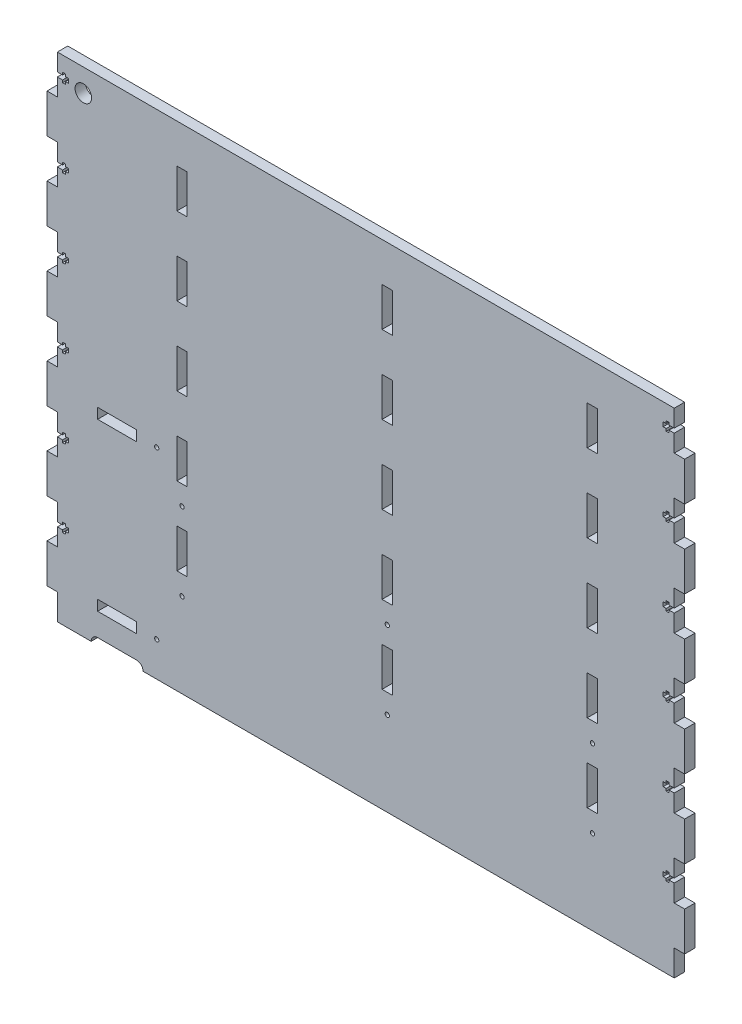
from build123d import *

# Parameters (mm, degrees)
SKETCH1_W           = 475
SKETCH1_H           = 380
SKETCH1_R           = 6.35
SKETCH1_R_2         = 1.65
SKETCH1_W_2         = 8
SKETCH1_H_2         = 30
SKETCH1_W_3         = 30
SKETCH1_H_3         = 8
BOSS_EXTRUDE1_DEPTH = 8
SKETCH2_W           = 8
SKETCH2_H           = 30
BOSS_EXTRUDE2_DEPTH = 8
CUT_EXTRUDE2_DEPTH  = 615.616140367


with BuildPart() as part:
    # Sketch1 → Boss-Extrude1 (new body)
    with BuildSketch(Plane.XY):
        with Locations((237.5, 190)):
            Rectangle(SKETCH1_W, SKETCH1_H)
        with Locations((20, 362.5)):
            Circle(SKETCH1_R, mode=Mode.SUBTRACT)
        with Locations((76.5, 154.566938385)):
            Circle(SKETCH1_R_2, mode=Mode.SUBTRACT)
        with Locations((76.5, 26.566938385)):
            Circle(SKETCH1_R_2, mode=Mode.SUBTRACT)
        with Locations((96, 125)):
            Circle(SKETCH1_R_2, mode=Mode.SUBTRACT)
        with Locations((254, 125)):
            Circle(SKETCH1_R_2, mode=Mode.SUBTRACT)
        with Locations((412, 125)):
            Circle(SKETCH1_R_2, mode=Mode.SUBTRACT)
        with Locations((96, 65)):
            Circle(SKETCH1_R_2, mode=Mode.SUBTRACT)
        with Locations((254, 65)):
            Circle(SKETCH1_R_2, mode=Mode.SUBTRACT)
        with Locations((412, 65)):
            Circle(SKETCH1_R_2, mode=Mode.SUBTRACT)
        with Locations((254, 335)):
            Rectangle(SKETCH1_W_2, SKETCH1_H_2, mode=Mode.SUBTRACT)
        with Locations((46, 154.566938385)):
            Rectangle(SKETCH1_W_3, SKETCH1_H_3, mode=Mode.SUBTRACT)
        with Locations((46, 26.566938385)):
            Rectangle(SKETCH1_W_3, SKETCH1_H_3, mode=Mode.SUBTRACT)
        with Locations((96, 335)):
            Rectangle(SKETCH1_W_2, SKETCH1_H_2, mode=Mode.SUBTRACT)
        with Locations((412, 335)):
            Rectangle(SKETCH1_W_2, SKETCH1_H_2, mode=Mode.SUBTRACT)
        with Locations((96, 275)):
            Rectangle(SKETCH1_W_2, SKETCH1_H_2, mode=Mode.SUBTRACT)
        with Locations((254, 275)):
            Rectangle(SKETCH1_W_2, SKETCH1_H_2, mode=Mode.SUBTRACT)
        with Locations((412, 275)):
            Rectangle(SKETCH1_W_2, SKETCH1_H_2, mode=Mode.SUBTRACT)
        with Locations((96, 215)):
            Rectangle(SKETCH1_W_2, SKETCH1_H_2, mode=Mode.SUBTRACT)
        with Locations((254, 215)):
            Rectangle(SKETCH1_W_2, SKETCH1_H_2, mode=Mode.SUBTRACT)
        with Locations((412, 215)):
            Rectangle(SKETCH1_W_2, SKETCH1_H_2, mode=Mode.SUBTRACT)
        with Locations((96, 155)):
            Rectangle(SKETCH1_W_2, SKETCH1_H_2, mode=Mode.SUBTRACT)
        with Locations((254, 155)):
            Rectangle(SKETCH1_W_2, SKETCH1_H_2, mode=Mode.SUBTRACT)
        with Locations((412, 155)):
            Rectangle(SKETCH1_W_2, SKETCH1_H_2, mode=Mode.SUBTRACT)
        with Locations((96, 95)):
            Rectangle(SKETCH1_W_2, SKETCH1_H_2, mode=Mode.SUBTRACT)
        with Locations((254, 95)):
            Rectangle(SKETCH1_W_2, SKETCH1_H_2, mode=Mode.SUBTRACT)
        with Locations((412, 95)):
            Rectangle(SKETCH1_W_2, SKETCH1_H_2, mode=Mode.SUBTRACT)
    extrude(amount=BOSS_EXTRUDE1_DEPTH)

    # Sketch2 → Boss-Extrude2 (add)
    with BuildSketch(Plane.XY.offset(8)):
        with Locations((479, 335)):
            Rectangle(SKETCH2_W, SKETCH2_H)
        with Locations((-4, 335)):
            Rectangle(SKETCH2_W, SKETCH2_H)
        with Locations((-4, 275)):
            Rectangle(SKETCH2_W, SKETCH2_H)
        with Locations((479, 275)):
            Rectangle(SKETCH2_W, SKETCH2_H)
        with Locations((-4, 215)):
            Rectangle(SKETCH2_W, SKETCH2_H)
        with Locations((479, 215)):
            Rectangle(SKETCH2_W, SKETCH2_H)
        with Locations((-4, 155)):
            Rectangle(SKETCH2_W, SKETCH2_H)
        with Locations((479, 155)):
            Rectangle(SKETCH2_W, SKETCH2_H)
        with Locations((-4, 95)):
            Rectangle(SKETCH2_W, SKETCH2_H)
        with Locations((479, 95)):
            Rectangle(SKETCH2_W, SKETCH2_H)
        with Locations((-4, 35)):
            Rectangle(SKETCH2_W, SKETCH2_H)
        with Locations((479, 35)):
            Rectangle(SKETCH2_W, SKETCH2_H)
    extrude(amount=-BOSS_EXTRUDE2_DEPTH)

    # Sketch4 → Cut-Extrude2 (cut, through all)
    with BuildSketch(Plane.XY.offset(8)):
        Polygon((475, 366.65), (471, 366.65), (471, 368.5), (468.8, 368.5), (468.8, 366.65), (466.5, 366.65), (466.5, 363.35), (468.8, 363.35), (468.8, 361.5), (471, 361.5), (471, 363.35), (475, 363.35), align=None)
        Polygon((0, 66.65), (0, 63.35), (4, 63.35), (4, 61.5), (6.2, 61.5), (6.2, 63.35), (8.5, 63.35), (8.5, 66.65), (6.2, 66.65), (6.2, 68.5), (4, 68.5), (4, 66.65), align=None)
        Polygon((0, 126.65), (0, 123.35), (4, 123.35), (4, 121.5), (6.2, 121.5), (6.2, 123.35), (8.5, 123.35), (8.5, 126.65), (6.2, 126.65), (6.2, 128.5), (4, 128.5), (4, 126.65), align=None)
        Polygon((0, 186.65), (0, 183.35), (4, 183.35), (4, 181.5), (6.2, 181.5), (6.2, 183.35), (8.5, 183.35), (8.5, 186.65), (6.2, 186.65), (6.2, 188.5), (4, 188.5), (4, 186.65), align=None)
        Polygon((0, 246.65), (0, 243.35), (4, 243.35), (4, 241.5), (6.2, 241.5), (6.2, 243.35), (8.5, 243.35), (8.5, 246.65), (6.2, 246.65), (6.2, 248.5), (4, 248.5), (4, 246.65), align=None)
        Polygon((0, 306.65), (0, 303.35), (4, 303.35), (4, 301.5), (6.2, 301.5), (6.2, 303.35), (8.5, 303.35), (8.5, 306.65), (6.2, 306.65), (6.2, 308.5), (4, 308.5), (4, 306.65), align=None)
        Polygon((0, 366.65), (0, 363.35), (4, 363.35), (4, 361.5), (6.2, 361.5), (6.2, 363.35), (8.5, 363.35), (8.5, 366.65), (6.2, 366.65), (6.2, 368.5), (4, 368.5), (4, 366.65), align=None)
        with BuildLine():
            Line((31, 5), (61, 5))
            ThreePointArc((61, 5), (66, 0), (61, -5))
            Line((61, -5), (31, -5))
            ThreePointArc((31, -5), (26, 0), (31, 5))
        make_face()
        Polygon((475, 306.65), (471, 306.65), (471, 308.5), (468.8, 308.5), (468.8, 306.65), (466.5, 306.65), (466.5, 303.35), (468.8, 303.35), (468.8, 301.5), (471, 301.5), (471, 303.35), (475, 303.35), align=None)
        Polygon((475, 246.65), (471, 246.65), (471, 248.5), (468.8, 248.5), (468.8, 246.65), (466.5, 246.65), (466.5, 243.35), (468.8, 243.35), (468.8, 241.5), (471, 241.5), (471, 243.35), (475, 243.35), align=None)
        Polygon((475, 186.65), (471, 186.65), (471, 188.5), (468.8, 188.5), (468.8, 186.65), (466.5, 186.65), (466.5, 183.35), (468.8, 183.35), (468.8, 181.5), (471, 181.5), (471, 183.35), (475, 183.35), align=None)
        Polygon((475, 126.65), (471, 126.65), (471, 128.5), (468.8, 128.5), (468.8, 126.65), (466.5, 126.65), (466.5, 123.35), (468.8, 123.35), (468.8, 121.5), (471, 121.5), (471, 123.35), (475, 123.35), align=None)
        Polygon((475, 66.65), (471, 66.65), (471, 68.5), (468.8, 68.5), (468.8, 66.65), (466.5, 66.65), (466.5, 63.35), (468.8, 63.35), (468.8, 61.5), (471, 61.5), (471, 63.35), (475, 63.35), align=None)
    extrude(amount=-CUT_EXTRUDE2_DEPTH, mode=Mode.SUBTRACT)


solid = part.part
